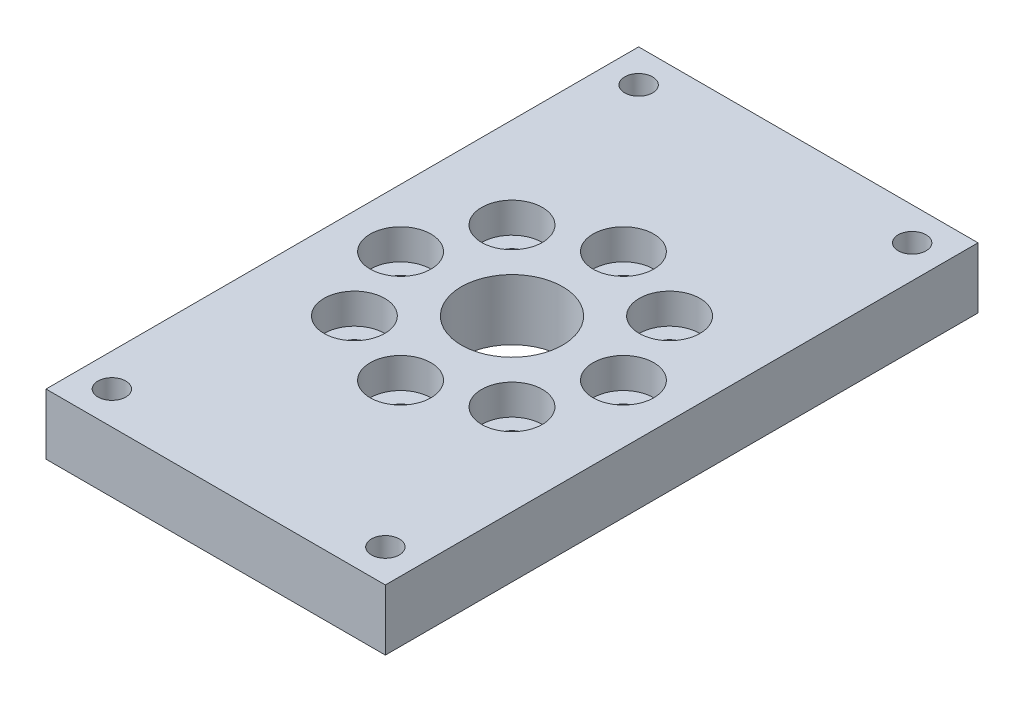
from build123d import *

# Parameters (mm, degrees)
SKETCH1_W             = 58.5
SKETCH1_H             = 33.5
SKETCH1_R             = 1.375
BOSS_EXTRUDE1_DEPTH   = 6
SKETCH2_R             = 1.375
CUT_EXTRUDE1_DEPTH    = 19
SKETCH3_R             = 5
CUT_EXTRUDE2_DEPTH    = 19
SKETCH4_R             = 3
CUT_EXTRUDE3_DEPTH    = 3
SKETCH5_R             = 3
CUT_EXTRUDE4_DEPTH    = 3
BODY_MOVE_COPY1_ANGLE = 120
BODY_MOVE_COPY2_ANGLE = 90


with BuildPart() as part:
    # Sketch1 → Boss-Extrude1 (new body)
    with BuildSketch(Plane(origin=(0, 0, 0), x_dir=(1, 0, 0), z_dir=(0, 1, 0))):
        Rectangle(SKETCH1_W, SKETCH1_H)
        with Locations((-26, 13.5)):
            Circle(SKETCH1_R, mode=Mode.SUBTRACT)
        with Locations((-26, -13.5)):
            Circle(SKETCH1_R, mode=Mode.SUBTRACT)
        with Locations((26, 13.5)):
            Circle(SKETCH1_R, mode=Mode.SUBTRACT)
        with Locations((26, -13.5)):
            Circle(SKETCH1_R, mode=Mode.SUBTRACT)
    extrude(amount=BOSS_EXTRUDE1_DEPTH)

    # Sketch2 → Cut-Extrude1 (cut)
    with BuildSketch(Plane(origin=(0, 6, 0), x_dir=(1, 0, 0), z_dir=(0, 1, 0))):
        with Locations((0, 11)):
            Circle(SKETCH2_R)
        with Locations((7.778174593, 7.778174593)):
            Circle(SKETCH2_R)
        with Locations((11, 0)):
            Circle(SKETCH2_R)
        with Locations((7.778174593, -7.778174593)):
            Circle(SKETCH2_R)
        with Locations((0, -11)):
            Circle(SKETCH2_R)
        with Locations((-7.778174593, -7.778174593)):
            Circle(SKETCH2_R)
        with Locations((-11, 0)):
            Circle(SKETCH2_R)
        with Locations((-7.778174593, 7.778174593)):
            Circle(SKETCH2_R)
    extrude(amount=-CUT_EXTRUDE1_DEPTH, mode=Mode.SUBTRACT)

    # Sketch3 → Cut-Extrude2 (cut)
    with BuildSketch(Plane(origin=(0, 6, 0), x_dir=(1, 0, 0), z_dir=(0, 1, 0))):
        Circle(SKETCH3_R)
    extrude(amount=-CUT_EXTRUDE2_DEPTH, mode=Mode.SUBTRACT)

    # Sketch4 → Cut-Extrude3 (cut)
    with BuildSketch(Plane(origin=(0, 6, 0), x_dir=(1, 0, 0), z_dir=(0, 1, 0))):
        with Locations((-7.778174593, 7.778174593)):
            Circle(SKETCH4_R)
        with Locations((0, 11)):
            Circle(SKETCH4_R)
        with Locations((7.778174593, 7.778174593)):
            Circle(SKETCH4_R)
        with Locations((11, 0)):
            Circle(SKETCH4_R)
        with Locations((7.778174593, -7.778174593)):
            Circle(SKETCH4_R)
        with Locations((0, -11)):
            Circle(SKETCH4_R)
        with Locations((-7.778174593, -7.778174593)):
            Circle(SKETCH4_R)
        with Locations((-11, 0)):
            Circle(SKETCH4_R)
    extrude(amount=-CUT_EXTRUDE3_DEPTH, mode=Mode.SUBTRACT)

    # Sketch5 → Cut-Extrude4 (cut)
    with BuildSketch(Plane.XZ):
        with Locations((-26, 13.5)):
            Circle(SKETCH5_R)
        with Locations((26, 13.5)):
            Circle(SKETCH5_R)
        with Locations((26, -13.5)):
            Circle(SKETCH5_R)
        with Locations((-26, -13.5)):
            Circle(SKETCH5_R)
    extrude(amount=-CUT_EXTRUDE4_DEPTH, mode=Mode.SUBTRACT)


with BuildPart() as part_1:
    # Body-Move/Copy1: moved
    add(part.part.moved(Location((0, 0, 0))).rotate(Axis((-1, 2, 1), (-0.5773502691896272, -0.5773502691896252, 0.5773502691896252)), BODY_MOVE_COPY1_ANGLE))


with BuildPart() as part_2:
    # Body-Move/Copy2: moved
    add(part_1.part.rotate(Axis((0, 3, 0), (1, 0, 0)), BODY_MOVE_COPY2_ANGLE))


solid = part_2.part
